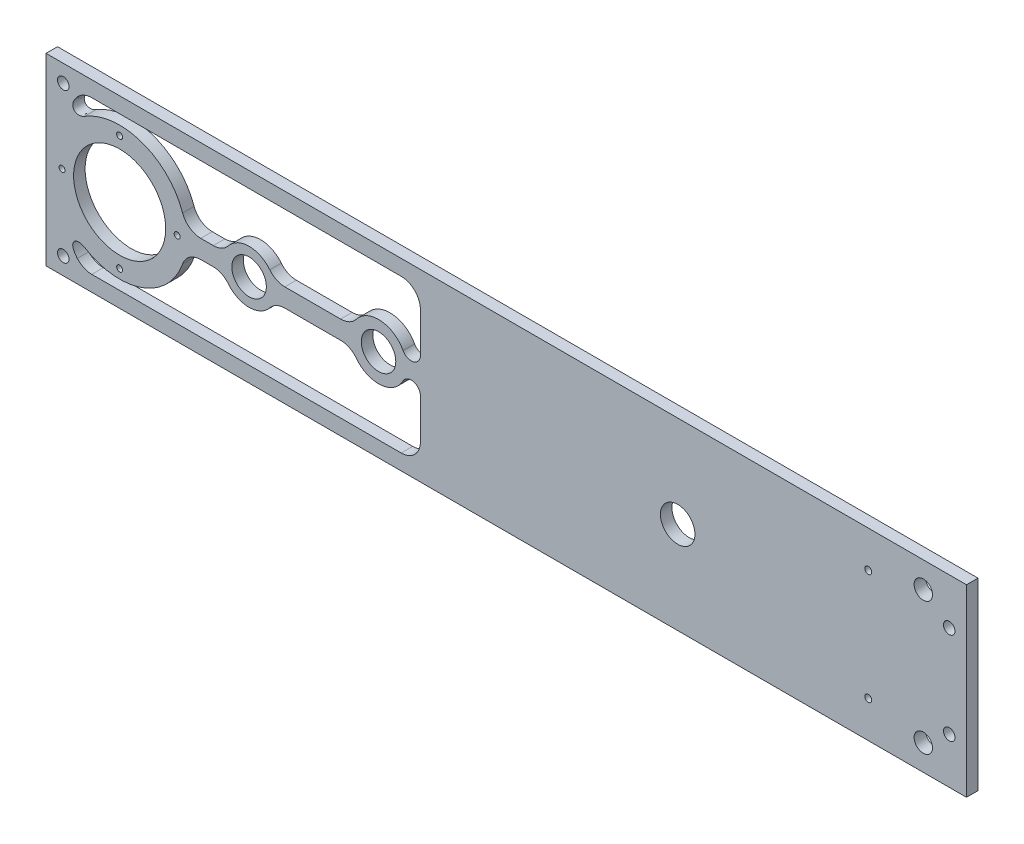
from build123d import *

# Parameters (mm, degrees)
SKETCH1_W           = 508
SKETCH1_H           = 101.6
BOSS_EXTRUDE1_DEPTH = 6.35
SKETCH2_R           = 25.4
SKETCH2_R_2         = 1.651
MOTOR_MOUNT_DEPTH   = 6.35
SKETCH3_R           = 9.525
SKETCH3_R_2         = 1.905
SKETCH3_R_3         = 5.08
CUT_EXTRUDE2_DEPTH  = 511.573170564
SKETCH4_R           = 3.175
CUT_EXTRUDE3_DEPTH  = 511.573170564
CUT_EXTRUDE4_DEPTH  = 511.573170564


with BuildPart() as part:
    # Sketch1 → Boss-Extrude1 (new body)
    with BuildSketch(Plane.XY):
        with Locations((254, 0)):
            Rectangle(SKETCH1_W, SKETCH1_H)
    extrude(amount=-BOSS_EXTRUDE1_DEPTH)

    # Sketch2 → Motor mount (cut)
    with BuildSketch(Plane.XY):
        with Locations((40.64, 0)):
            Circle(SKETCH2_R)
        with Locations((72.39, 0)):
            Circle(SKETCH2_R_2)
        with Locations((40.64, -31.75)):
            Circle(SKETCH2_R_2)
        with Locations((8.89, 0)):
            Circle(SKETCH2_R_2)
        with Locations((40.64, 31.75)):
            Circle(SKETCH2_R_2)
    extrude(amount=-MOTOR_MOUNT_DEPTH, mode=Mode.SUBTRACT)

    # Sketch3 → Cut-Extrude2 (cut, through all)
    with BuildSketch(Plane.XY):
        with Locations((112.0775, 0)):
            Circle(SKETCH3_R)
        with Locations((183.515, 0)):
            Circle(SKETCH3_R)
        with Locations((348.615, 0)):
            Circle(SKETCH3_R)
        with Locations((453.806353407, -30.582171978)):
            Circle(SKETCH3_R_2)
        with Locations((484.169453271, -36.573492277)):
            Circle(SKETCH3_R_3)
        with Locations((484.169453271, 36.573492277)):
            Circle(SKETCH3_R_3)
        with Locations((453.806353407, 30.582171978)):
            Circle(SKETCH3_R_2)
    extrude(amount=-CUT_EXTRUDE2_DEPTH, mode=Mode.SUBTRACT)

    # Sketch4 → Cut-Extrude3 (cut, through all)
    with BuildSketch(Plane.XY):
        with Locations((9.525, 41.275)):
            Circle(SKETCH4_R)
        with Locations((9.525, -41.275)):
            Circle(SKETCH4_R)
        with Locations((498.475, 25.4)):
            Circle(SKETCH4_R)
        with Locations((498.475, -25.4)):
            Circle(SKETCH4_R)
    extrude(amount=-CUT_EXTRUDE3_DEPTH, mode=Mode.SUBTRACT)

    # Sketch7 → Cut-Extrude4 (cut, through all)
    with BuildSketch(Plane.XY):
        with BuildLine():
            Line((85.406292789, 5.08), (92.341412089, 5.08))
            ThreePointArc((92.341412089, 5.08), (96.950572969, 6.134064693), (100.643442411, 9.08671294))
            ThreePointArc((100.643442411, 9.08671294), (112.0775, 14.605), (123.511557589, 9.08671294))
            ThreePointArc((123.511557589, 9.08671294), (127.204427031, 6.134064693), (131.813587911, 5.08))
            Line((131.813587911, 5.08), (162.585112959, 5.08))
            ThreePointArc((162.585112959, 5.08), (167.45975122, 6.214203951), (171.333000793, 9.383818205))
            ThreePointArc((171.333000793, 9.383818205), (184.777760897, 15.325227036), (197.068677539, 7.263261936))
            ThreePointArc((197.068677539, 7.263261936), (202.783248212, 4.735656121), (206.626270766, 9.662753319))
            Line((206.626270766, 9.662753319), (206.626270766, 31.603209647))
            ThreePointArc((206.626270766, 31.603209647), (203.520318205, 39.101642443), (196.02188541, 42.207595003))
            Line((196.02188541, 42.207595003), (25.263102588, 42.207595003))
            ThreePointArc((25.263102588, 42.207595003), (20.881723867, 41.260150637), (17.283250038, 38.587115578))
            add(Edge.make_bspline(
                [(17.283250038, 38.587115578), (11.530533455, 32.014027317), (16.787146308, 28.551640426), (21.263438452, 31.320883809)],
                knots=[0, 0, 0, 0, 1, 1, 1, 1], degree=3))
            ThreePointArc((21.263438452, 31.320883809), (52.918543043, 34.722993545), (75.39838363, 12.177999321))
            ThreePointArc((75.39838363, 12.177999321), (79.271558889, 7.034643814), (85.406292789, 5.08))
        make_face()
    cut_extrude4 = extrude(amount=-CUT_EXTRUDE4_DEPTH, mode=Mode.SUBTRACT)

    # Mirror1: Cut-Extrude4 across plane
    add(cut_extrude4.mirror(Plane.ZX), mode=Mode.SUBTRACT)


solid = part.part
